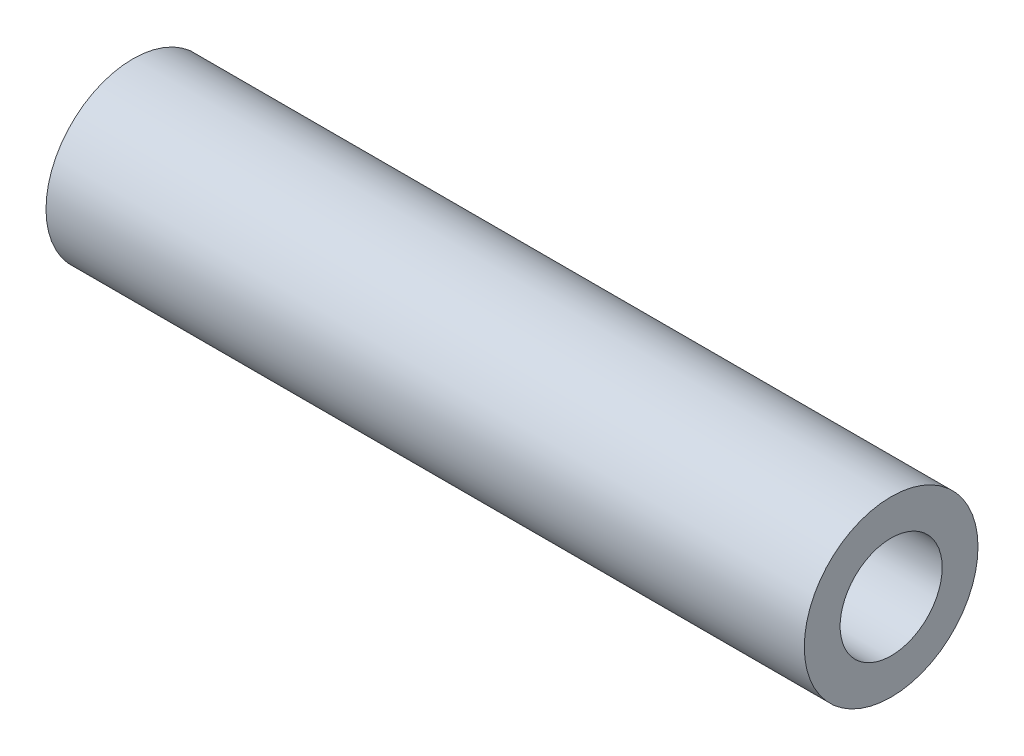
from build123d import *

# Parameters (mm, degrees)
SKETCH1_R           = 4
SKETCH1_R_2         = 2.35
BOSS_EXTRUDE1_DEPTH = 34.925


with BuildPart() as part:
    # Sketch1 → Boss-Extrude1 (new body)
    with BuildSketch(Plane(origin=(0, 0, 0), x_dir=(0, 0, -1), z_dir=(1, 0, 0))):
        Circle(SKETCH1_R)
        Circle(SKETCH1_R_2, mode=Mode.SUBTRACT)
    extrude(amount=BOSS_EXTRUDE1_DEPTH)


solid = part.part
